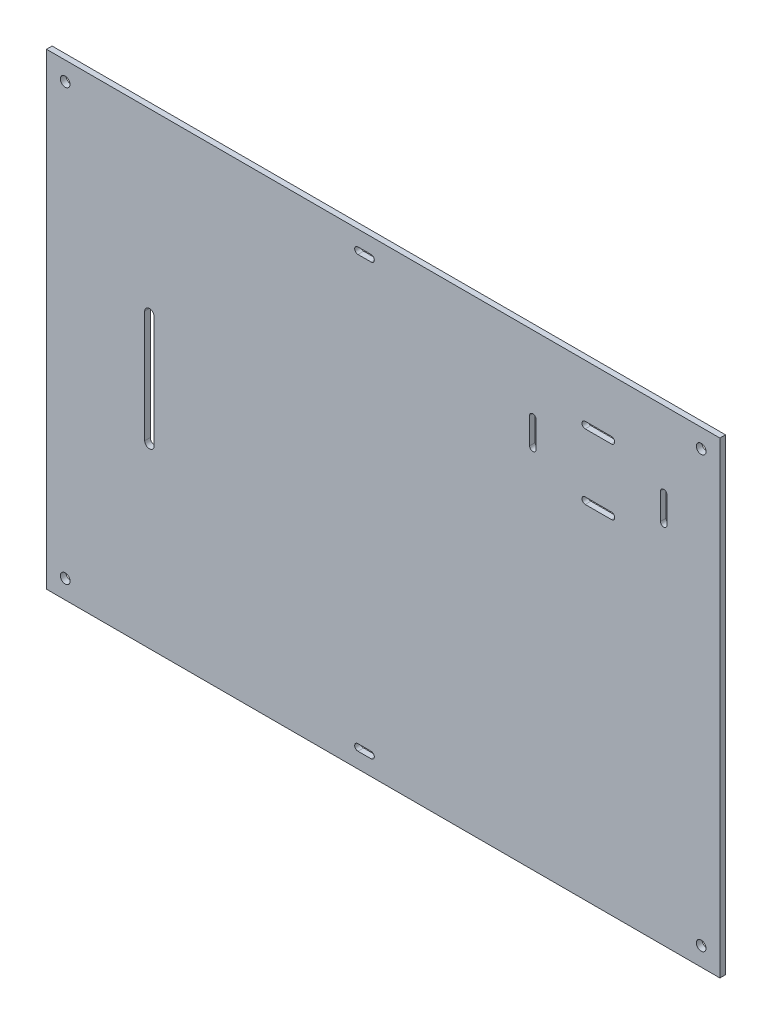
from build123d import *

# Parameters (mm, degrees)
SKETCH1_W                  = 360
SKETCH1_H                  = 250
BASE_FLANGE1_DEPTH         = 3
F_6_0_204_DIAMETER_SLOT1_D = 5.1816
CUT_EXTRUDE1_DEPTH         = 10
CUT_EXTRUDE2_DEPTH         = 10
CUT_EXTRUDE4_DEPTH         = 10
CUT_EXTRUDE5_DEPTH         = 10
CUT_EXTRUDE6_DEPTH         = 10
CUT_EXTRUDE7_DEPTH         = 10
CUT_EXTRUDE8_DEPTH         = 10


# Sheet-metal steps are written as plain solids
with BuildPart() as part:
    # Sketch1 → Base-Flange1 (new body)
    with BuildSketch(Plane.XY):
        Rectangle(SKETCH1_W, SKETCH1_H)
    extrude(amount=-BASE_FLANGE1_DEPTH)

    # #6 (0.204) Diameter Slot1 (through all)
    with Locations(Plane.XY):
        with Locations((-170, -115), (-170, 115), (170, 115), (170, -115)):
            Hole(F_6_0_204_DIAMETER_SLOT1_D / 2)

    # Sketch8 → Cut-Extrude1 (cut)
    with BuildSketch(Plane.XY):
        with BuildLine():
            Line((-13.5, -113.25), (-6.5, -113.25))
            ThreePointArc((-6.5, -113.25), (-4.75, -115), (-6.5, -116.75))
            Line((-6.5, -116.75), (-13.5, -116.75))
            ThreePointArc((-13.5, -116.75), (-15.25, -115), (-13.5, -113.25))
        make_face()
    extrude(amount=-CUT_EXTRUDE1_DEPTH, mode=Mode.SUBTRACT)

    # Sketch9 → Cut-Extrude2 (cut)
    with BuildSketch(Plane.XY):
        with BuildLine():
            Line((-13.5, 116.75), (-6.5, 116.75))
            ThreePointArc((-6.5, 116.75), (-4.75, 115), (-6.5, 113.25))
            Line((-6.5, 113.25), (-13.5, 113.25))
            ThreePointArc((-13.5, 113.25), (-15.25, 115), (-13.5, 116.75))
        make_face()
    extrude(amount=-CUT_EXTRUDE2_DEPTH, mode=Mode.SUBTRACT)

    # Sketch10 → Cut-Extrude4 (cut)
    with BuildSketch(Plane.XY):
        with BuildLine():
            Line((151.75, 84.5), (151.75, 70.5))
            ThreePointArc((151.75, 70.5), (150, 68.75), (148.25, 70.5))
            Line((148.25, 70.5), (148.25, 84.5))
            ThreePointArc((148.25, 84.5), (150, 86.25), (151.75, 84.5))
        make_face()
    extrude(amount=-CUT_EXTRUDE4_DEPTH, mode=Mode.SUBTRACT)

    # Sketch11 → Cut-Extrude5 (cut)
    with BuildSketch(Plane.XY):
        with BuildLine():
            Line((108, 96.75), (122, 96.75))
            ThreePointArc((122, 96.75), (123.75, 95), (122, 93.25))
            Line((122, 93.25), (108, 93.25))
            ThreePointArc((108, 93.25), (106.25, 95), (108, 96.75))
        make_face()
    extrude(amount=-CUT_EXTRUDE5_DEPTH, mode=Mode.SUBTRACT)

    # Sketch12 → Cut-Extrude6 (cut)
    with BuildSketch(Plane.XY):
        with BuildLine():
            Line((108, 61.75), (122, 61.75))
            ThreePointArc((122, 61.75), (123.75, 60), (122, 58.25))
            Line((122, 58.25), (108, 58.25))
            ThreePointArc((108, 58.25), (106.25, 60), (108, 61.75))
        make_face()
    extrude(amount=-CUT_EXTRUDE6_DEPTH, mode=Mode.SUBTRACT)

    # Sketch13 → Cut-Extrude7 (cut)
    with BuildSketch(Plane.XY):
        with BuildLine():
            Line((81.75, 84.5), (81.75, 70.5))
            ThreePointArc((81.75, 70.5), (80, 68.75), (78.25, 70.5))
            Line((78.25, 70.5), (78.25, 84.5))
            ThreePointArc((78.25, 84.5), (80, 86.25), (81.75, 84.5))
        make_face()
    extrude(amount=-CUT_EXTRUDE7_DEPTH, mode=Mode.SUBTRACT)

    # Sketch14 → Cut-Extrude8 (cut)
    with BuildSketch(Plane.XY):
        with BuildLine():
            Line((-122.5, 30), (-122.5, -30))
            ThreePointArc((-122.5, -30), (-125, -32.5), (-127.5, -30))
            Line((-127.5, -30), (-127.5, 30))
            ThreePointArc((-127.5, 30), (-125, 32.5), (-122.5, 30))
        make_face()
    extrude(amount=-CUT_EXTRUDE8_DEPTH, mode=Mode.SUBTRACT)


solid = part.part
